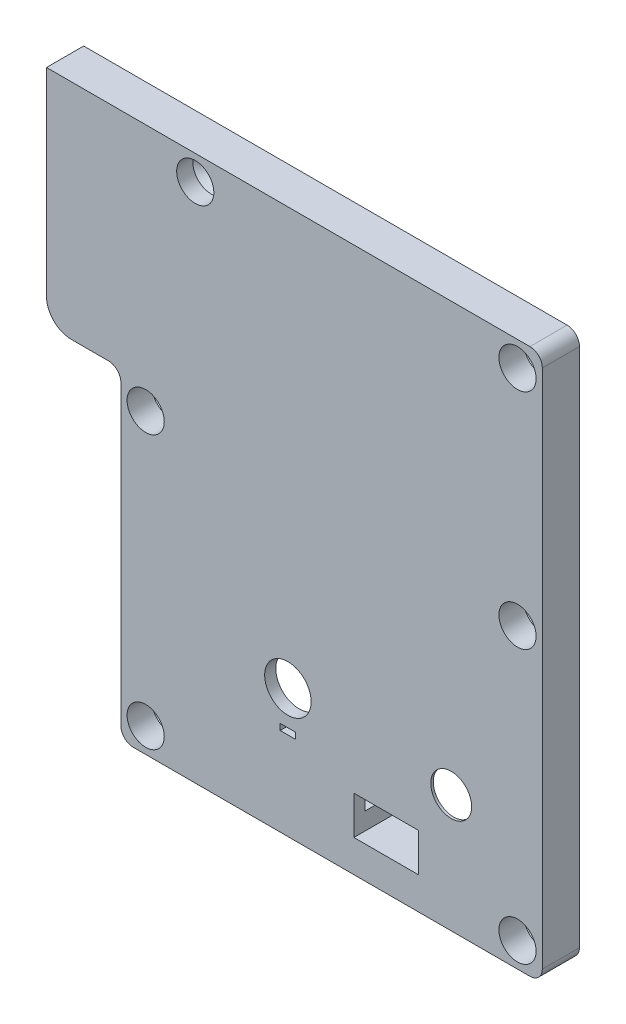
from build123d import *

# Parameters (mm, degrees)
EXTRUDE_1_DEPTH          = 6
EXTRUDE_4_DEPTH          = 6.8
CUT_EXTRUDE_START        = -1.8
CUT_EXTRUDE_6_DEPTH      = 110.619208398
FILLET_1_R               = 2
CUT_EXTRUDE_4_DEPTH      = 112.419208398
CUT_EXTRUDE_4_DEPTH_BACK = 112.419208398
SKETCH_4_R               = 1.6
SKETCH_5_R               = 3.75
SKETCH_5_W               = 10.4
SKETCH_5_H               = 6.2
SKETCH_5_W_2             = 2.5
SKETCH_5_H_2             = 1
SKETCH_5_W_3             = 9.4
SKETCH_5_H_3             = 11.4
CUT_EXTRUDE_5_DEPTH      = 112.419208398
SKETCH_5_3_W             = 9.4
SKETCH_5_3_H             = 11.4
SKETCH_5_3_R             = 3.3
EXTRUDE_5_DEPTH          = 0.4
SKETCH_6_W               = 20
SKETCH_6_H               = 36
EXTRUDE_7_DEPTH          = 6
FILLET_2_R               = 2
FILLET_3_R               = 4
SKETCH_7_R               = 1.4
CUT_EXTRUDE_7_DEPTH      = 20
SKETCH_4_3_R             = 3
SKETCH_4_3_R_2           = 1.6
CUT_EXTRUDE_8_DEPTH      = 4
SKETCH_8_R               = 1.4
CUT_EXTRUDE_9_DEPTH      = 7
CHAMFER_1_SIZE           = 1.4


with BuildPart() as part:
    # 草图1 → 凸台-拉伸1 (new body)
    with BuildSketch(Plane.XY):
        Polygon((0, 0), (68, 0), (68, 88), (8, 88), (8, 52), (0, 52), align=None)
    extrude(amount=-EXTRUDE_1_DEPTH)

    # 草图1<2> → 凸台-拉伸4 (add)
    with BuildSketch(Plane.XY):
        Polygon((2.2, 49.8), (2.2, 2.2), (65.8, 2.2), (65.8, 85.8), (10.2, 85.8), (10.2, 49.8), align=None)
        Polygon((8, 44), (8, 8), (60, 8), (60, 80), (16, 80), (16, 44), align=None, mode=Mode.SUBTRACT)
    extrude(amount=-EXTRUDE_4_DEPTH)

    # 草图1<5> → 切除-拉伸6 (cut, through all)
    with BuildSketch(Plane.XY.offset(CUT_EXTRUDE_START)):
        Polygon((16, 80), (16, 44), (8, 44), (8, 8), (60, 8), (60, 80), align=None)
    extrude(amount=-CUT_EXTRUDE_6_DEPTH, mode=Mode.SUBTRACT)

    # 圆角1
    fillet_1_edges = [part.edges().sort_by_distance(p)[0] for p in [
        (68, 88, -3),
        (68, 0, -3),
        (0, 0, -3),
        (10.2, 85.8, -6.4),
        (65.8, 85.8, -6.4),
        (65.8, 2.2, -6.4),
        (2.2, 2.2, -6.4),
        (2.2, 49.8, -6.4),
    ]]
    fillet(fillet_1_edges, radius=FILLET_1_R)

    # 草图4 → 切除-拉伸4 (cut, two sides: drawn at the far end of the back side and taken through both)
    with BuildSketch(Plane.XY.offset(-CUT_EXTRUDE_4_DEPTH_BACK)):
        with Locations((12, 84)):
            Circle(SKETCH_4_R)
        with Locations((64, 84)):
            Circle(SKETCH_4_R)
        with Locations((64, 4)):
            Circle(SKETCH_4_R)
        with Locations((4, 48)):
            Circle(SKETCH_4_R)
        with Locations((4, 4)):
            Circle(SKETCH_4_R)
        with Locations((64, 48)):
            Circle(SKETCH_4_R)
    extrude(amount=CUT_EXTRUDE_4_DEPTH + CUT_EXTRUDE_4_DEPTH_BACK, mode=Mode.SUBTRACT)

    # 草图5 → 切除-拉伸5 (cut, through all)
    with BuildSketch(Plane.XY):
        with Locations((26.95, 20.7)):
            Circle(SKETCH_5_R)
        with Locations((42.8, 8.3)):
            Rectangle(SKETCH_5_W, SKETCH_5_H)
        with Locations((26.95, 14.7)):
            Rectangle(SKETCH_5_W_2, SKETCH_5_H_2)
        with Locations((53.3, 18.1)):
            Rectangle(SKETCH_5_W_3, SKETCH_5_H_3)
    extrude(amount=-CUT_EXTRUDE_5_DEPTH, mode=Mode.SUBTRACT)

    # 草图5<3> → 凸台-拉伸5 (add)
    with BuildSketch(Plane.XY):
        with Locations((53.3, 18.1)):
            Rectangle(SKETCH_5_3_W, SKETCH_5_3_H)
        with Locations((53.3, 19)):
            Circle(SKETCH_5_3_R, mode=Mode.SUBTRACT)
    extrude(amount=-EXTRUDE_5_DEPTH)

    # 草图6 → 凸台-拉伸7 (add)
    with BuildSketch(Plane.XY):
        with Locations((-2, 70)):
            Rectangle(SKETCH_6_W, SKETCH_6_H)
    extrude(amount=-EXTRUDE_7_DEPTH)

    # 圆角2
    fillet_2_edges = [part.edges().sort_by_distance(p)[0] for p in [
        (0, 52, -3),
    ]]
    fillet(fillet_2_edges, radius=FILLET_2_R)

    # 圆角3
    fillet_3_edges = [part.edges().sort_by_distance(p)[0] for p in [
        (-12, 52, -3),
    ]]
    fillet(fillet_3_edges, radius=FILLET_3_R)

    # 草图7 → 切除-拉伸7 (cut)
    with BuildSketch(Plane.ZY.offset(12)):
        with Locations((-3, 82)):
            Circle(SKETCH_7_R)
        with Locations((-3, 62)):
            Circle(SKETCH_7_R)
    extrude(amount=-CUT_EXTRUDE_7_DEPTH, mode=Mode.SUBTRACT)

    # 草图4<3> → 切除-拉伸8 (cut)
    # profile 1 of 6: a face of its own
    with BuildSketch(Plane.XY):
        with Locations((12, 84)):
            Circle(SKETCH_4_3_R)
        with Locations((12, 84)):
            Circle(SKETCH_4_3_R_2, mode=Mode.SUBTRACT)
    # profile 2 of 6: a face of its own
    with BuildSketch(Plane.XY):
        with Locations((64, 84)):
            Circle(SKETCH_4_3_R)
        with Locations((64, 84)):
            Circle(SKETCH_4_3_R_2, mode=Mode.SUBTRACT)
    # profile 3 of 6: a face of its own
    with BuildSketch(Plane.XY):
        with Locations((4, 48)):
            Circle(SKETCH_4_3_R)
        with Locations((4, 48)):
            Circle(SKETCH_4_3_R_2, mode=Mode.SUBTRACT)
    # profile 4 of 6: a face of its own
    with BuildSketch(Plane.XY):
        with Locations((64, 48)):
            Circle(SKETCH_4_3_R)
        with Locations((64, 48)):
            Circle(SKETCH_4_3_R_2, mode=Mode.SUBTRACT)
    # profile 5 of 6: a face of its own
    with BuildSketch(Plane.XY):
        with Locations((4, 4)):
            Circle(SKETCH_4_3_R)
        with Locations((4, 4)):
            Circle(SKETCH_4_3_R_2, mode=Mode.SUBTRACT)
    # profile 6 of 6: a face of its own
    with BuildSketch(Plane.XY):
        with Locations((64, 4)):
            Circle(SKETCH_4_3_R)
        with Locations((64, 4)):
            Circle(SKETCH_4_3_R_2, mode=Mode.SUBTRACT)
    extrude(amount=-CUT_EXTRUDE_8_DEPTH, mode=Mode.SUBTRACT)

    # 草图8 → 切除-拉伸9 (cut)
    with BuildSketch(Plane.XZ):
        with Locations(Location((58, -3, 0), (0, 0, 270))):
            Circle(SKETCH_8_R)
        with Locations(Location((10, -3, 0), (0, 0, 270))):
            Circle(SKETCH_8_R)
        with Locations(Location((34, -3, 0), (0, 0, 270))):
            Circle(SKETCH_8_R)
    extrude(amount=-CUT_EXTRUDE_9_DEPTH, mode=Mode.SUBTRACT)

    # 倒角1
    chamfer_1_edges = [part.edges().sort_by_distance(p)[0] for p in [
        (2.4, 4, -4),
        (62.4, 48, -4),
        (2.4, 48, -4),
        (62.4, 84, -4),
        (62.4, 4, -4),
        (9, 84, -4),
    ]]
    chamfer(chamfer_1_edges, length=CHAMFER_1_SIZE - 0.0001)  # a hair under: the kernel refuses the full size


solid = part.part
